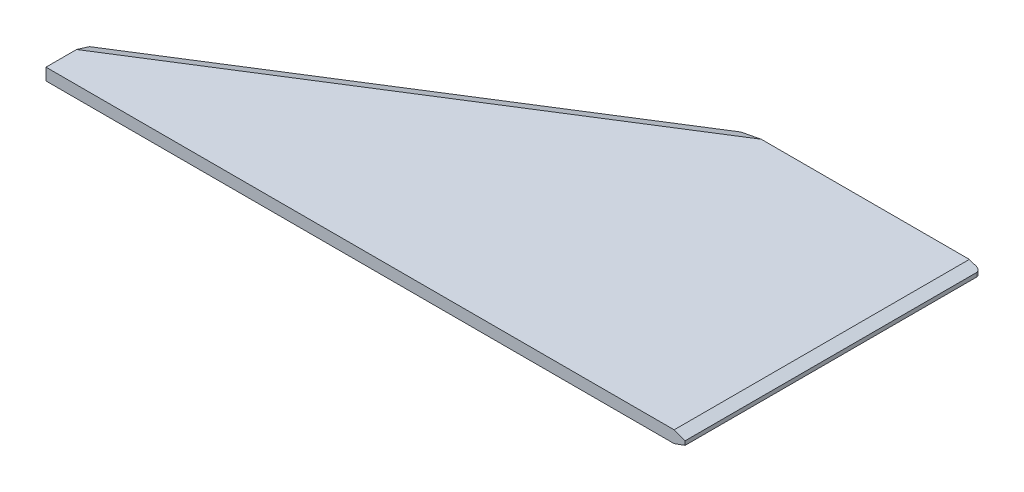
from build123d import *
from OCP.BRepFilletAPI import BRepFilletAPI_MakeChamfer

# Parameters (mm, degrees)
BOSS_EXTRUDE1_DEPTH = 3
CHAMFER1_SIZE       = 1
CHAMFER1_SIZE2      = 2.747477419
CHAMFER2_SIZE       = 1
CHAMFER2_SIZE2      = 2.747477419
FILLET1_R           = 1


with BuildPart() as part:
    # Sketch1 → Boss-Extrude1 (new body)
    with BuildSketch(Plane(origin=(0, 0, 0), x_dir=(1, 0, 0), z_dir=(0, 1, 0))):
        Polygon((0, 0), (0, 10.9), (100, 73.9), (160, 73.9), (160, 10.9), (160, 0), (152.5, 0), (149, 0), align=None)
    extrude(amount=BOSS_EXTRUDE1_DEPTH)

    # Chamfer1: one chamfer whose edges measure the first distance from different faces: ONE call of the kernel's chamfer builder (chamfer() names one face for all edges)
    chamfer1_edges_1 = [part.edges().sort_by_distance(p)[0] for p in [
        (160, 3, -36.95),
    ]]
    chamfer1_side_1 = [part.faces().sort_by_distance(p)[0] for p in [
        (160, 1.5, -36.95),
    ]]
    chamfer1_edges_2 = [part.edges().sort_by_distance(p)[0] for p in [
        (50, 3, -42.4),
    ]]
    chamfer1_side_2 = [part.faces().sort_by_distance(p)[0] for p in [
        (50, 1.5, -42.4),
    ]]
    chamfer1 = BRepFilletAPI_MakeChamfer(part.part.solid().wrapped)
    for e in chamfer1_edges_1:
        chamfer1.Add(CHAMFER1_SIZE, CHAMFER1_SIZE2, e.wrapped, chamfer1_side_1[0].wrapped)  # the first distance lies on this face
    for e in chamfer1_edges_2:
        chamfer1.Add(CHAMFER1_SIZE, CHAMFER1_SIZE2, e.wrapped, chamfer1_side_2[0].wrapped)  # the first distance lies on this face
    add(Compound.cast(chamfer1.Shape()), mode=Mode.REPLACE)

    # Chamfer2: one chamfer whose edges measure the first distance from different faces: ONE call of the kernel's chamfer builder (chamfer() names one face for all edges)
    chamfer2_edges_1 = [part.edges().sort_by_distance(p)[0] for p in [
        (50, 0, -42.4),
    ]]
    chamfer2_side_1 = [part.faces().sort_by_distance(p)[0] for p in [
        (50, 1, -42.4),
    ]]
    chamfer2_edges_2 = [part.edges().sort_by_distance(p)[0] for p in [
        (160, 0, -36.95),
    ]]
    chamfer2_side_2 = [part.faces().sort_by_distance(p)[0] for p in [
        (160, 1, -36.95),
    ]]
    chamfer2 = BRepFilletAPI_MakeChamfer(part.part.solid().wrapped)
    for e in chamfer2_edges_1:
        chamfer2.Add(CHAMFER2_SIZE, CHAMFER2_SIZE2, e.wrapped, chamfer2_side_1[0].wrapped)  # the first distance lies on this face
    for e in chamfer2_edges_2:
        chamfer2.Add(CHAMFER2_SIZE, CHAMFER2_SIZE2, e.wrapped, chamfer2_side_2[0].wrapped)  # the first distance lies on this face
    add(Compound.cast(chamfer2.Shape()), mode=Mode.REPLACE)

    # Fillet1
    fillet1_edges = [part.edges().sort_by_distance(p)[0] for p in [
        (160, 1.5, -73.9),
    ]]
    fillet(fillet1_edges, radius=FILLET1_R)


solid = part.part
